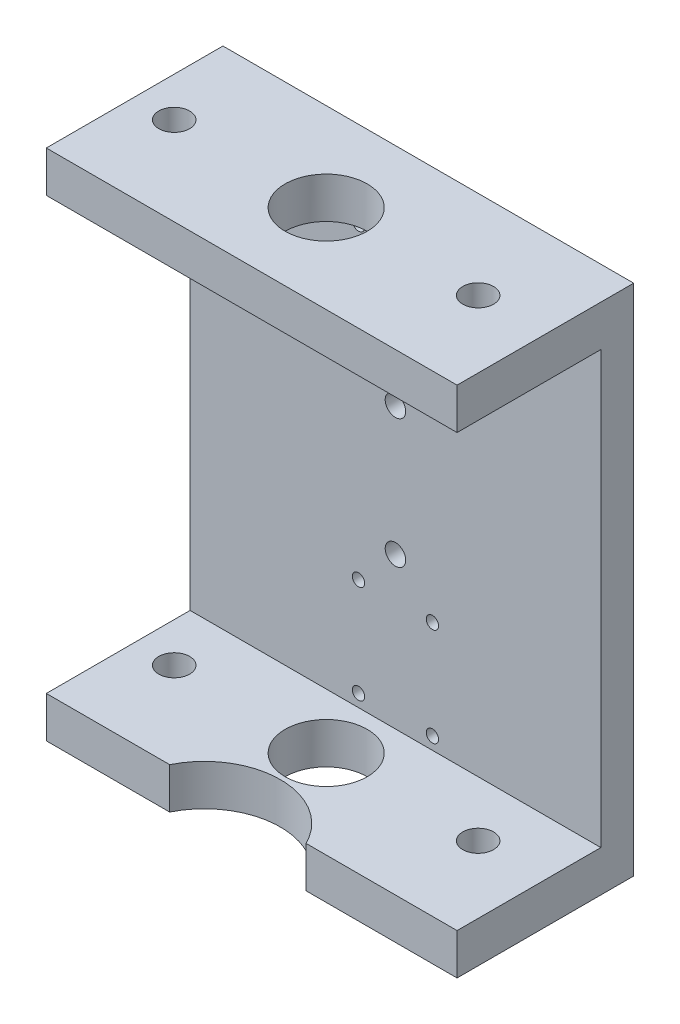
from build123d import *

# Parameters (mm, degrees)
SKETCH2_W           = 100
SKETCH2_H           = 125
SKETCH2_R           = 1.5
SKETCH2_R_2         = 2.5
BOSS_EXTRUDE1_DEPTH = 8
SKETCH5_W           = 100
SKETCH5_H           = 10
BOSS_EXTRUDE2_DEPTH = 35
SKETCH7_R           = 10
SKETCH7_R_2         = 3.75
CUT_EXTRUDE2_DEPTH  = 290
SKETCH8_R           = 18.5
CUT_EXTRUDE5_DEPTH  = 133.566964211


with BuildPart() as part:
    # Sketch2 → Boss-Extrude1 (new body)
    with BuildSketch(Plane.XY):
        with Locations((0, 17.5)):
            Rectangle(SKETCH2_W, SKETCH2_H)
        with Locations((-9, -8.03563588)):
            Circle(SKETCH2_R, mode=Mode.SUBTRACT)
        with Locations((9, -31.96436412)):
            Circle(SKETCH2_R, mode=Mode.SUBTRACT)
        with Locations((9, -8.03563588)):
            Circle(SKETCH2_R, mode=Mode.SUBTRACT)
        with Locations((-9, -31.96436412)):
            Circle(SKETCH2_R, mode=Mode.SUBTRACT)
        with Locations((9, 43.03563588)):
            Circle(SKETCH2_R, mode=Mode.SUBTRACT)
        with Locations((-9, 43.03563588)):
            Circle(SKETCH2_R, mode=Mode.SUBTRACT)
        with Locations((-9, 66.96436412)):
            Circle(SKETCH2_R, mode=Mode.SUBTRACT)
        with Locations((9, 66.96436412)):
            Circle(SKETCH2_R, mode=Mode.SUBTRACT)
        with Locations((0, 33.18)):
            Circle(SKETCH2_R_2, mode=Mode.SUBTRACT)
        with Locations((0, 1.82)):
            Circle(SKETCH2_R_2, mode=Mode.SUBTRACT)
    extrude(amount=BOSS_EXTRUDE1_DEPTH)

    # Sketch5 → Boss-Extrude2 (add)
    with BuildSketch(Plane.XY.offset(8)):
        with Locations((0, 75)):
            Rectangle(SKETCH5_W, SKETCH5_H)
        with Locations((0, -40)):
            Rectangle(SKETCH5_W, SKETCH5_H)
    extrude(amount=BOSS_EXTRUDE2_DEPTH)

    # Sketch7 → Cut-Extrude2 (cut)
    with BuildSketch(Plane(origin=(0, 80, 0), x_dir=(1, 0, 0), z_dir=(0, 1, 0))):
        with Locations((-3.365, -21.5)):
            Circle(SKETCH7_R)
        with Locations((-40.365, -21.5)):
            Circle(SKETCH7_R_2)
        with Locations((33.635, -21.5)):
            Circle(SKETCH7_R_2)
    extrude(amount=-CUT_EXTRUDE2_DEPTH, mode=Mode.SUBTRACT)

    # Sketch8 → Cut-Extrude5 (cut, through all)
    with BuildSketch(Plane(origin=(0, -35, 0), x_dir=(1, 0, 0), z_dir=(0, 1, 0))):
        with Locations((-3.365, -51.164787316)):
            Circle(SKETCH8_R)
    extrude(amount=-CUT_EXTRUDE5_DEPTH, mode=Mode.SUBTRACT)


solid = part.part
